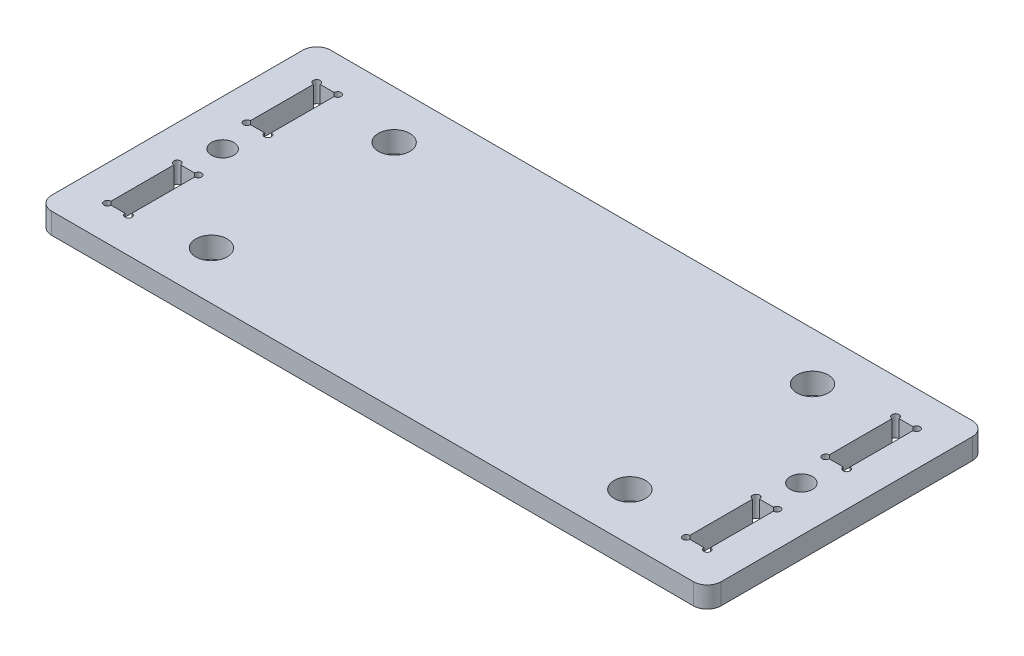
from build123d import *

# Parameters (mm, degrees)
SKETCH1_R           = 2.25
SKETCH1_R_2         = 1.6
SKETCH1_W           = 3
SKETCH1_H           = 10
BOSS_EXTRUDE1_DEPTH = 3
SKETCH2_R           = 0.5
CUT_EXTRUDE1_DEPTH  = 53.086466572


with BuildPart() as part:
    # Sketch1 → Boss-Extrude1 (new body)
    with BuildSketch(Plane(origin=(0, 0, 0), x_dir=(1, 0, 0), z_dir=(0, 1, 0))):
        with BuildLine():
            Line((-46, -20), (46, -20))
            ThreePointArc((46, -20), (47.414213562, -19.414213562), (48, -18))
            Line((48, -18), (48, 18))
            ThreePointArc((48, 18), (47.414213562, 19.414213562), (46, 20))
            Line((46, 20), (-46, 20))
            ThreePointArc((-46, 20), (-47.414213562, 19.414213562), (-48, 18))
            Line((-48, 18), (-48, -18))
            ThreePointArc((-48, -18), (-47.414213562, -19.414213562), (-46, -20))
        make_face()
        with Locations((-30, 13.1)):
            Circle(SKETCH1_R, mode=Mode.SUBTRACT)
        with Locations((30, 13.1)):
            Circle(SKETCH1_R, mode=Mode.SUBTRACT)
        with Locations((30, -13.1)):
            Circle(SKETCH1_R, mode=Mode.SUBTRACT)
        with Locations((-30, -13.1)):
            Circle(SKETCH1_R, mode=Mode.SUBTRACT)
        with Locations((41.5, 0)):
            Circle(SKETCH1_R_2, mode=Mode.SUBTRACT)
        with Locations((-41.5, 0)):
            Circle(SKETCH1_R_2, mode=Mode.SUBTRACT)
        with Locations((-41.5, 10)):
            Rectangle(SKETCH1_W, SKETCH1_H, mode=Mode.SUBTRACT)
        with Locations((-41.5, -10)):
            Rectangle(SKETCH1_W, SKETCH1_H, mode=Mode.SUBTRACT)
        with Locations((41.5, 10)):
            Rectangle(SKETCH1_W, SKETCH1_H, mode=Mode.SUBTRACT)
        with Locations((41.5, -10)):
            Rectangle(SKETCH1_W, SKETCH1_H, mode=Mode.SUBTRACT)
    extrude(amount=BOSS_EXTRUDE1_DEPTH)

    # Sketch2 → Cut-Extrude1 (cut, through all)
    with BuildSketch(Plane(origin=(0, 3, 0), x_dir=(1, 0, 0), z_dir=(0, 1, 0))):
        with Locations((-43, 15)):
            Circle(SKETCH2_R)
        with Locations((-40, 15)):
            Circle(SKETCH2_R)
        with Locations((-40, 5)):
            Circle(SKETCH2_R)
        with Locations((-43, 5)):
            Circle(SKETCH2_R)
        with Locations((-43, -5)):
            Circle(SKETCH2_R)
        with Locations((-40, -5)):
            Circle(SKETCH2_R)
        with Locations((-43, -15)):
            Circle(SKETCH2_R)
        with Locations((-40, -15)):
            Circle(SKETCH2_R)
        with Locations((40, -15)):
            Circle(SKETCH2_R)
        with Locations((43, -15)):
            Circle(SKETCH2_R)
        with Locations((43, -5)):
            Circle(SKETCH2_R)
        with Locations((40, -5)):
            Circle(SKETCH2_R)
        with Locations((40, 5)):
            Circle(SKETCH2_R)
        with Locations((43, 5)):
            Circle(SKETCH2_R)
        with Locations((43, 15)):
            Circle(SKETCH2_R)
        with Locations((40, 15)):
            Circle(SKETCH2_R)
    extrude(amount=-CUT_EXTRUDE1_DEPTH, mode=Mode.SUBTRACT)


solid = part.part
